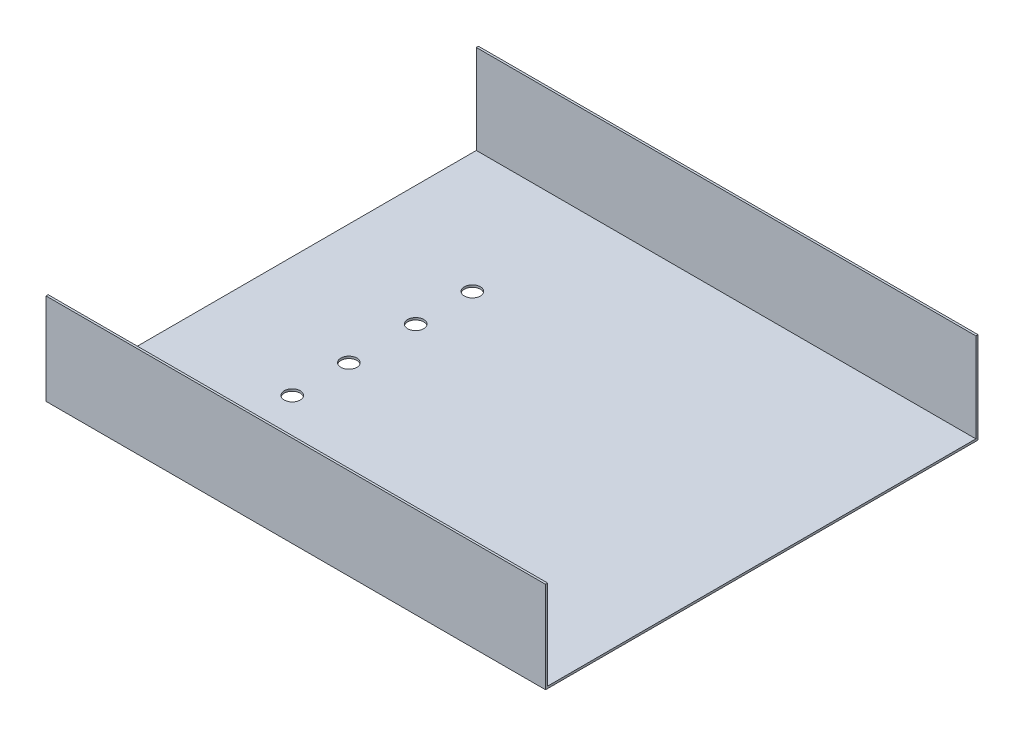
from build123d import *

# Parameters (mm, degrees)
CROQUIS1_W                   = 120
CROQUIS1_H                   = 25
SALIENTE_EXTRUIR1_DEPTH      = 140
VACIADO1_T                   = 0.6
TALADRO_DE_MARGEN_PARA_M41_D = 4.5


with BuildPart() as part:
    # Croquis1 → Saliente-Extruir1 (new body)
    with BuildSketch(Plane(origin=(0, 0, 0), x_dir=(0, 0, -1), z_dir=(1, 0, 0))):
        with Locations((60, 12.5)):
            Rectangle(CROQUIS1_W, CROQUIS1_H)
    extrude(amount=SALIENTE_EXTRUIR1_DEPTH)

    # Vaciado1
    vaciado1_openings = [part.faces().sort_by_distance(p)[0] for p in [
        (0, 12.5, -60),
        (140, 12.5, -60),
        (70, 25, -60),
    ]]
    offset(amount=VACIADO1_T, openings=vaciado1_openings, kind=Kind.INTERSECTION)

    # Taladro de margen para M41 (through all)
    with Locations(Plane(origin=(83.259459275, 0, -172.630862631), x_dir=(1, 0, 0), z_dir=(0, 1, 0))):
        with Locations((-49.609459275, -137.868362631), (-49.609459275, -87.393362631), (-49.609459275, -103.268362631), (-49.609459275, -121.993362631)):
            Hole(TALADRO_DE_MARGEN_PARA_M41_D / 2)


solid = part.part
